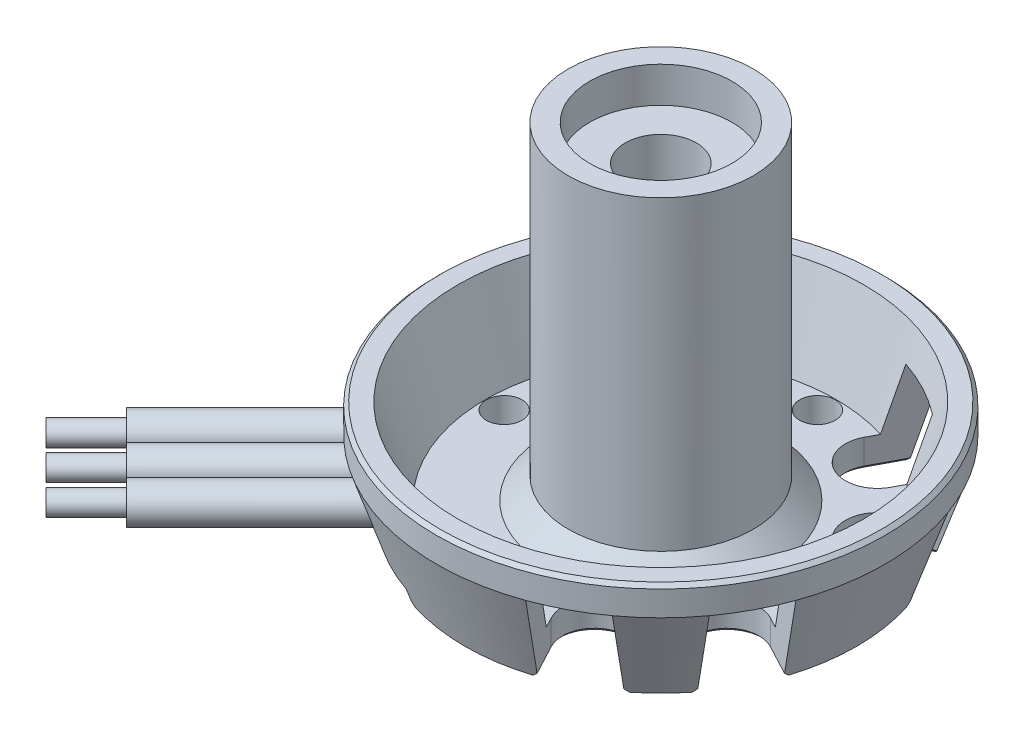
from build123d import *

# Parameters (mm, degrees)
SKETCH_3_R          = 31.5
EXTRUDE_1_DEPTH     = 81
SKETCH_4_R          = 2.5
CUT_EXTRUDE_1_DEPTH = 2
SKETCH_5_R          = 9
CUT_EXTRUDE_2_DEPTH = 1.2
SKETCH_6_R          = 5
EXTRUDE_2_DEPTH     = 40
SKETCH_9_W          = 1
SKETCH_9_H          = 0.5
CHAMFER_1_SIZE      = 1.2
SKETCH_11_R         = 2.5
CUT_EXTRUDE_3_DEPTH = 10
SKETCH_12_R         = 31.5
CUT_EXTRUDE_4_DEPTH = 79.80038071
SKETCH_13_R         = 5
CUT_EXTRUDE_5_DEPTH = 71.622517655
SKETCH_8_R          = 2.5
EXTRUDE_3_DEPTH     = 40
SKETCH_15_R         = 28.5
CUT_EXTRUDE_6_DEPTH = 12
CUT_EXTRUDE_6_DRAFT = -18
SKETCH_16_R         = 13
SKETCH_16_R_2       = 10
EXTRUDE_4_DEPTH     = 46
CHAMFER_2_SIZE      = 3
EXTRUDE_START       = -15
SKETCH_21_R         = 10
SKETCH_21_R_2       = 5
EXTRUDE_7_DEPTH     = 10
SKETCH_22_R         = 1.5
EXTRUDE_8_DEPTH     = 8
CHAMFER_4_SIZE      = 0.5
CHAMFER1_SIZE       = 0.5


with BuildPart() as part:
    # 草图3 → 凸台-拉伸1 (new body)
    with BuildSketch(Plane(origin=(0, 0, 0), x_dir=(1, 0, 0), z_dir=(0, 1, 0))):
        with Locations(Location((0, 0, 0), (0, 0, 270))):
            Circle(SKETCH_3_R)
    extrude(amount=EXTRUDE_1_DEPTH)

    # 草图4 → 切除-拉伸1 (cut)
    with BuildSketch(Plane.XZ):
        with Locations(Location((0, 22, 0), (0, 0, 270))):
            Circle(SKETCH_4_R)
        with Locations(Location((0, -22, 0), (0, 0, 90))):
            Circle(SKETCH_4_R)
        with Locations(Location((-22, 0, 0), (0, 0, 270))):
            Circle(SKETCH_4_R)
        with Locations(Location((22, 0, 0), (0, 0, 90))):
            Circle(SKETCH_4_R)
        with BuildLine():
            Line((6.589845995, 21.978942872), (10.81509006, 29.925471208))
            ThreePointArc((10.81509006, 29.925471208), (16.90097626, 31.786113343), (18.761618396, 25.700227143))
            Line((18.761618396, 25.700227143), (14.536374331, 17.753698807))
            ThreePointArc((14.536374331, 17.753698807), (8.45048813, 15.893056671), (6.589845995, 21.978942872))
        make_face()
        with BuildLine():
            Line((21.978942872, 6.589845995), (29.925471208, 10.81509006))
            ThreePointArc((29.925471208, 10.81509006), (31.786113343, 16.90097626), (25.700227143, 18.761618396))
            Line((25.700227143, 18.761618396), (17.753698807, 14.536374331))
            ThreePointArc((17.753698807, 14.536374331), (15.893056671, 8.45048813), (21.978942872, 6.589845995))
        make_face()
        with BuildLine():
            Line((-6.589845995, 21.978942872), (-10.81509006, 29.925471208))
            ThreePointArc((-10.81509006, 29.925471208), (-16.90097626, 31.786113343), (-18.761618396, 25.700227143))
            Line((-18.761618396, 25.700227143), (-14.536374331, 17.753698807))
            ThreePointArc((-14.536374331, 17.753698807), (-8.45048813, 15.893056671), (-6.589845995, 21.978942872))
        make_face()
        with BuildLine():
            Line((-21.978942872, 6.589845995), (-29.925471208, 10.81509006))
            ThreePointArc((-29.925471208, 10.81509006), (-31.786113343, 16.90097626), (-25.700227143, 18.761618396))
            Line((-25.700227143, 18.761618396), (-17.753698807, 14.536374331))
            ThreePointArc((-17.753698807, 14.536374331), (-15.893056671, 8.45048813), (-21.978942872, 6.589845995))
        make_face()
        with BuildLine():
            Line((6.589845995, -21.978942872), (10.81509006, -29.925471208))
            ThreePointArc((10.81509006, -29.925471208), (16.90097626, -31.786113343), (18.761618396, -25.700227143))
            Line((18.761618396, -25.700227143), (14.536374331, -17.753698807))
            ThreePointArc((14.536374331, -17.753698807), (8.45048813, -15.893056671), (6.589845995, -21.978942872))
        make_face()
        with BuildLine():
            Line((21.978942872, -6.589845995), (29.925471208, -10.81509006))
            ThreePointArc((29.925471208, -10.81509006), (31.786113343, -16.90097626), (25.700227143, -18.761618396))
            Line((25.700227143, -18.761618396), (17.753698807, -14.536374331))
            ThreePointArc((17.753698807, -14.536374331), (15.893056671, -8.45048813), (21.978942872, -6.589845995))
        make_face()
        with BuildLine():
            Line((-6.589845995, -21.978942872), (-10.81509006, -29.925471208))
            ThreePointArc((-10.81509006, -29.925471208), (-16.90097626, -31.786113343), (-18.761618396, -25.700227143))
            Line((-18.761618396, -25.700227143), (-14.536374331, -17.753698807))
            ThreePointArc((-14.536374331, -17.753698807), (-8.45048813, -15.893056671), (-6.589845995, -21.978942872))
        make_face()
        with BuildLine():
            Line((-21.978942872, -6.589845995), (-29.925471208, -10.81509006))
            ThreePointArc((-29.925471208, -10.81509006), (-31.786113343, -16.90097626), (-25.700227143, -18.761618396))
            Line((-25.700227143, -18.761618396), (-17.753698807, -14.536374331))
            ThreePointArc((-17.753698807, -14.536374331), (-15.893056671, -8.45048813), (-21.978942872, -6.589845995))
        make_face()
    extrude(amount=-CUT_EXTRUDE_1_DEPTH, mode=Mode.SUBTRACT)

    # 草图5 → 切除-拉伸2 (cut)
    with BuildSketch(Plane.XZ):
        with Locations(Location((0, 0, 0), (0, 0, 270))):
            Circle(SKETCH_5_R)
    extrude(amount=-CUT_EXTRUDE_2_DEPTH, mode=Mode.SUBTRACT)

    # 草图6 → 凸台-拉伸2 (add)
    with BuildSketch(Plane.XZ.offset(-1.2)):
        with Locations(Location((0, 0, 0), (0, 0, 270))):
            Circle(SKETCH_6_R)
    extrude(amount=EXTRUDE_2_DEPTH)

    # 草图9 → 切除-旋转1 (revolve, cut)
    with BuildSketch(Plane(origin=(0, 0, 0), x_dir=(0, 0, -1), z_dir=(1, 0, 0)), mode=Mode.PRIVATE) as cut_revolve_1_sk:
        Polygon((-31.5, 0), (-31.5, -3.75), (-35.25, 0), align=None)
        with Locations((-31, 16.25)):
            Rectangle(SKETCH_9_W, SKETCH_9_H)
    revolve(cut_revolve_1_sk.sketch.rotate(Axis((0, 0, 0), (0, 1, 0)), 180), axis=Axis((0, 0, 0), (0, 1, 0)), mode=Mode.SUBTRACT)

    # 倒角1
    chamfer_1_edges = [part.edges().sort_by_distance(p)[0] for p in [
        (0, 1.2, 9),
    ]]
    chamfer(chamfer_1_edges, length=CHAMFER_1_SIZE - 0.0001)  # a hair under: the kernel refuses the full size

    # 草图11 → 切除-拉伸3 (cut)
    with BuildSketch(Plane.XZ.offset(-2)):
        with Locations(Location((22, 0, 0), (0, 0, 90))):
            Circle(SKETCH_11_R)
        with Locations(Location((0, -22, 0), (0, 0, 90))):
            Circle(SKETCH_11_R)
        with Locations(Location((-22, 0, 0), (0, 0, 270))):
            Circle(SKETCH_11_R)
        with Locations(Location((0, 22, 0), (0, 0, 270))):
            Circle(SKETCH_11_R)
        with BuildLine():
            Line((14.536374331, 17.753698807), (22.514790794, 32.758917801))
            ThreePointArc((22.514790794, 32.758917801), (18.661494621, 35.097166816), (14.568262458, 36.984161866))
            Line((14.568262458, 36.984161866), (6.589845995, 21.978942872))
            ThreePointArc((6.589845995, 21.978942872), (8.45048813, 15.893056671), (14.536374331, 17.753698807))
        make_face()
        with BuildLine():
            Line((32.758917801, 22.514790794), (17.753698807, 14.536374331))
            ThreePointArc((17.753698807, 14.536374331), (15.893056671, 8.45048813), (21.978942872, 6.589845995))
            Line((21.978942872, 6.589845995), (36.984161866, 14.568262458))
            ThreePointArc((36.984161866, 14.568262458), (35.097166816, 18.661494621), (32.758917801, 22.514790794))
        make_face()
        with BuildLine():
            Line((17.753698807, -14.536374331), (32.758917801, -22.514790794))
            ThreePointArc((32.758917801, -22.514790794), (35.097166816, -18.661494621), (36.984161866, -14.568262458))
            Line((36.984161866, -14.568262458), (21.978942872, -6.589845995))
            ThreePointArc((21.978942872, -6.589845995), (15.893056671, -8.45048813), (17.753698807, -14.536374331))
        make_face()
        with BuildLine():
            Line((22.514790794, -32.758917801), (14.536374331, -17.753698807))
            ThreePointArc((14.536374331, -17.753698807), (8.45048813, -15.893056671), (6.589845995, -21.978942872))
            Line((6.589845995, -21.978942872), (14.568262458, -36.984161866))
            ThreePointArc((14.568262458, -36.984161866), (18.661494621, -35.097166816), (22.514790794, -32.758917801))
        make_face()
        with BuildLine():
            Line((-14.536374331, -17.753698807), (-22.514790794, -32.758917801))
            ThreePointArc((-22.514790794, -32.758917801), (-18.661494621, -35.097166816), (-14.568262458, -36.984161866))
            Line((-14.568262458, -36.984161866), (-6.589845995, -21.978942872))
            ThreePointArc((-6.589845995, -21.978942872), (-8.45048813, -15.893056671), (-14.536374331, -17.753698807))
        make_face()
        with BuildLine():
            Line((-32.758917801, -22.514790794), (-17.753698807, -14.536374331))
            ThreePointArc((-17.753698807, -14.536374331), (-15.893056671, -8.45048813), (-21.978942872, -6.589845995))
            Line((-21.978942872, -6.589845995), (-36.984161866, -14.568262458))
            ThreePointArc((-36.984161866, -14.568262458), (-35.097166816, -18.661494621), (-32.758917801, -22.514790794))
        make_face()
    extrude(amount=-CUT_EXTRUDE_3_DEPTH, mode=Mode.SUBTRACT)

    # Sketch2 → Cut-Revolve1 (revolve, cut)
    with BuildSketch(Plane.XY, mode=Mode.PRIVATE) as cut_revolve1_sk:
        Polygon((31.5, 12), (31.5, 0), (27.5, 0), align=None)
    revolve(cut_revolve1_sk.sketch.rotate(Axis((0, 0, 0), (0, -1, 0)), 270), axis=Axis((0, 0, 0), (0, -1, 0)), mode=Mode.SUBTRACT)

    # 草图12 → 切除-拉伸4 (cut, through all)
    with BuildSketch(Plane(origin=(0, 16, 0), x_dir=(1, 0, 0), z_dir=(0, 1, 0))):
        with Locations(Location((0, 0, 0), (0, 0, 90))):
            Circle(SKETCH_12_R)
    extrude(amount=CUT_EXTRUDE_4_DEPTH, mode=Mode.SUBTRACT)

    # 草图13 → 切除-拉伸5 (cut, through all)
    with BuildSketch(Plane.XZ.offset(38.8)):
        with Locations(Location((0, 0, 0), (0, 0, 270))):
            Circle(SKETCH_13_R)
    extrude(amount=-CUT_EXTRUDE_5_DEPTH, mode=Mode.SUBTRACT)

    # 草图8 → 凸台-拉伸3 (add)
    with BuildSketch(Plane(origin=(-9.232233047, 0, 9.232233047), x_dir=(0.7071067811865465, 0, 0.7071067811865487), z_dir=(-0.7071067811865487, 0, 0.7071067811865465))):
        with Locations(Location((0, 8, 0), (0, 0, 201.954156817))):
            Circle(SKETCH_8_R)
        with Locations(Location((6, 8, 0), (0, 0, 208.283654838))):
            Circle(SKETCH_8_R)
        with Locations(Location((-6, 8, 0), (0, 0, 180))):
            Circle(SKETCH_8_R)
    extrude(amount=EXTRUDE_3_DEPTH)


with BuildPart() as cut_extrude_6_tool:
    # 草图15 → 切除-拉伸6 (with draft: the straight prism first)
    with BuildSketch(Plane(origin=(0, 16, 0), x_dir=(1, 0, 0), z_dir=(0, 1, 0))):
        Circle(SKETCH_15_R)
    extrude(amount=-CUT_EXTRUDE_6_DEPTH)
    # 切除-拉伸6: the draft: its side faces are tilted about the plane it starts from
    cut_extrude_6_sides = [cut_extrude_6_tool.faces().sort_by_distance(p)[0] for p in [
        (-28.5, 10, 0),
    ]]
    draft(cut_extrude_6_sides, Plane(origin=(0, 16, 0), x_dir=(1, 0, 0), z_dir=(0, 1, 0)), CUT_EXTRUDE_6_DRAFT)


with BuildPart() as part_1:
    add(part.part)

    # 切除-拉伸6: cut by cut_extrude_6_tool
    add(cut_extrude_6_tool.part, mode=Mode.SUBTRACT)

    # 草图16 → 凸台-拉伸4 (add)
    with BuildSketch(Plane(origin=(0, 4, 0), x_dir=(1, 0, 0), z_dir=(0, 1, 0))):
        with Locations(Location((0, 0, 0), (0, 0, 270))):
            Circle(SKETCH_16_R)
        with Locations(Location((0, 0, 0), (0, 0, 270))):
            Circle(SKETCH_16_R_2, mode=Mode.SUBTRACT)
    extrude(amount=EXTRUDE_4_DEPTH)

    # 倒角2
    chamfer_2_edges = [part_1.edges().sort_by_distance(p)[0] for p in [
        (0, 4, -13),
    ]]
    chamfer(chamfer_2_edges, length=CHAMFER_2_SIZE)

    # 草图21 → 凸台-拉伸7 (add)
    with BuildSketch(Plane(origin=(0, 50, 0), x_dir=(1, 0, 0), z_dir=(0, 1, 0)).offset(EXTRUDE_START)):
        with Locations(Location((0, 0, 0), (0, 0, 270))):
            Circle(SKETCH_21_R)
        with Locations(Location((0, 0, 0), (0, 0, 90))):
            Circle(SKETCH_21_R_2, mode=Mode.SUBTRACT)
    extrude(amount=EXTRUDE_7_DEPTH)

    # 草图22 → 凸台-拉伸8 (add)
    with BuildSketch(Plane(origin=(-37.516504294, 0, 37.516504294), x_dir=(0.7071067811865465, 0, 0.7071067811865486), z_dir=(-0.7071067811865486, 0, 0.7071067811865465))):
        with Locations((6, 8)):
            Circle(SKETCH_22_R)
        with Locations((0, 8)):
            Circle(SKETCH_22_R)
        with Locations((-6, 8)):
            Circle(SKETCH_22_R)
    extrude(amount=EXTRUDE_8_DEPTH)

    # 倒角4
    chamfer_4_edges = [part_1.edges().sort_by_distance(p)[0] for p in [
        (15.893056671, 0, -8.45048813),
        (8.45048813, 0, -15.893056671),
        (7.676513026, 0, -24.022666317),
        (15.623041362, 0, -19.797422252),
        (24.022666317, 0, -7.676513026),
        (-24.022666317, 0, 7.676513026),
        (-15.623041362, 0, 19.797422252),
        (19.797422252, 0, 15.623041362),
        (-7.676513026, 0, -24.022666317),
        (-19.797422252, 0, -15.623041362),
        (-15.893056671, 0, -8.45048813),
        (-24.022666317, 0, -7.676513026),
        (-15.623041362, 0, -19.797422252),
        (-8.45048813, 0, -15.893056671),
        (7.676513026, 0, 24.022666317),
        (15.893056671, 0, 8.45048813),
        (24.022666317, 0, 7.676513026),
        (-8.45048813, 0, 15.893056671),
        (-7.676513026, 0, 24.022666317),
        (15.623041362, 0, 19.797422252),
        (-19.797422252, 0, 15.623041362),
        (-15.893056671, 0, 8.45048813),
        (8.45048813, 0, 15.893056671),
        (19.797422252, 0, -15.623041362),
    ]]
    chamfer(chamfer_4_edges, length=CHAMFER_4_SIZE)

    # Chamfer1
    chamfer1_edges = [part_1.edges().sort_by_distance(p)[0] for p in [
        (0, 16, -31.5),
    ]]
    chamfer(chamfer1_edges, length=CHAMFER1_SIZE)


solid = part_1.part
